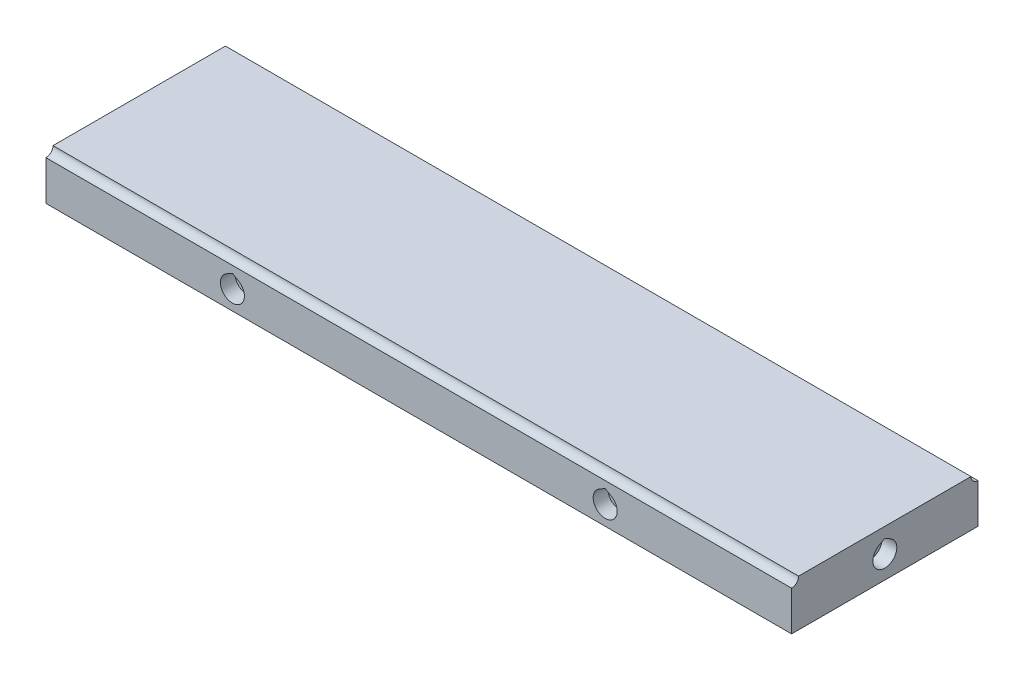
from build123d import *

# Parameters (mm, degrees)
SKETCH_1_W                         = 160
SKETCH_1_H                         = 40
EXTRUDE_1_DEPTH                    = 10
SWEEP_START                        = -80
SWEEP_1_DEPTH                      = 160
SWEEP_2_DEPTH                      = 160
SKETCH_16_R                        = 2.575
CUT_EXTRUDE_1_DEPTH                = 3.15
PATTERN_LINEAR_1_COUNT             = 2
PATTERN_LINEAR_1_PITCH             = 80
PATTERN_CIRCULAR_1_COUNT           = 2
PATTERN_CIRCULAR_1_COPY_1_SKETCH_R = 2.575
PATTERN_CIRCULAR_1_COPY_1_DEPTH    = 3.15
SKETCH_20_R                        = 2.575
CUT_EXTRUDE_2_DEPTH                = 3.15
PATTERN_CIRCULAR_2_COUNT           = 2


# Read off the part's stored shape, not the designer's step: Вырез-По траектории1, Вырез-По траектории2
with BuildPart() as part:
    # Эскиз1 → Бобышка-Вытянуть1 (new body)
    with BuildSketch(Plane(origin=(0, 0, 0), x_dir=(1, 0, 0), z_dir=(0, 1, 0))):
        Rectangle(SKETCH_1_W, SKETCH_1_H)
    extrude(amount=-EXTRUDE_1_DEPTH)

    # Вырез-По траектории1 outline → Вырез-По траектории1 (cut)
    with BuildSketch(Plane.YZ.offset(SWEEP_START)):
        with BuildLine():
            Line((0, 20), (-1.5, 20))
            ThreePointArc((-1.5, 20), (-1.060660172, 18.939339828), (0, 18.5))
            Line((0, 18.5), (0, 20))
        make_face()
    extrude(amount=SWEEP_1_DEPTH, mode=Mode.SUBTRACT)

    # Вырез-По траектории2 outline → Вырез-По траектории2 (cut)
    with BuildSketch(Plane.YZ.offset(SWEEP_START)):
        with BuildLine():
            ThreePointArc((0, -18.5), (-1.060660172, -18.939339828), (-1.5, -20))
            Line((-1.5, -20), (0, -20))
            Line((0, -20), (0, -18.5))
        make_face()
    extrude(amount=SWEEP_2_DEPTH, mode=Mode.SUBTRACT)

    # Эскиз16 → Вырез-Вытянуть1 (cut)
    with BuildSketch(Plane(origin=(0, 0, -20), x_dir=(-1, 0, 0), z_dir=(0, 0, -1))):
        with Locations((-40, -5.949176943)):
            Circle(SKETCH_16_R)
        with BuildLine():
            Line((-40, -2.975823057), (-41.2875, -3.719161528))
            ThreePointArc((-41.2875, -3.719161528), (-40, -3.374176943), (-38.7125, -3.719161528))
            Line((-38.7125, -3.719161528), (-40, -2.975823057))
        make_face()
    cut_extrude_1 = extrude(amount=-CUT_EXTRUDE_1_DEPTH, mode=Mode.SUBTRACT)

    # Линейный массив1: Вырез-Вытянуть1 ×2
    with Locations(*[(-i * PATTERN_LINEAR_1_PITCH, 0, 0) for i in range(1, PATTERN_LINEAR_1_COUNT)]):
        add(cut_extrude_1, mode=Mode.SUBTRACT)

    # Круговой массив1: Вырез-Вытянуть1 ×2 about axis
    pattern_circular_1_axis = Axis((0, -10, 0), (0, -1, 0))
    for i in range(1, PATTERN_CIRCULAR_1_COUNT):
        add(cut_extrude_1.rotate(pattern_circular_1_axis, i * 360 / PATTERN_CIRCULAR_1_COUNT), mode=Mode.SUBTRACT)

    # Круговой массив1 copy 1 sketch → Круговой массив1 copy 1 (cut)
    with BuildSketch(Plane(origin=(80, 0, 20), x_dir=(1, 0, 0), z_dir=(0, 0, 1))):
        with Locations((-40, -5.949176943)):
            Circle(PATTERN_CIRCULAR_1_COPY_1_SKETCH_R)
        with BuildLine():
            Line((-40, -2.975823057), (-41.2875, -3.719161528))
            ThreePointArc((-41.2875, -3.719161528), (-40, -3.374176943), (-38.7125, -3.719161528))
            Line((-38.7125, -3.719161528), (-40, -2.975823057))
        make_face()
    extrude(amount=-PATTERN_CIRCULAR_1_COPY_1_DEPTH, mode=Mode.SUBTRACT)

    # Эскиз20 → Вырез-Вытянуть2 (cut)
    with BuildSketch(Plane.ZY.offset(-80)):
        with Locations((0, -5.199176943)):
            Circle(SKETCH_20_R)
        with BuildLine():
            Line((1.2875, -2.969161528), (0, -2.225823057))
            Line((0, -2.225823057), (-1.2875, -2.969161528))
            ThreePointArc((-1.2875, -2.969161528), (0, -2.624176943), (1.2875, -2.969161528))
        make_face()
    cut_extrude_2 = extrude(amount=CUT_EXTRUDE_2_DEPTH, mode=Mode.SUBTRACT)

    # Круговой массив2: Вырез-Вытянуть2 ×2 about axis
    pattern_circular_2_axis = Axis((0, -10, 0), (0, -1, 0))
    for i in range(1, PATTERN_CIRCULAR_2_COUNT):
        add(cut_extrude_2.rotate(pattern_circular_2_axis, i * 360 / PATTERN_CIRCULAR_2_COUNT), mode=Mode.SUBTRACT)


solid = part.part
